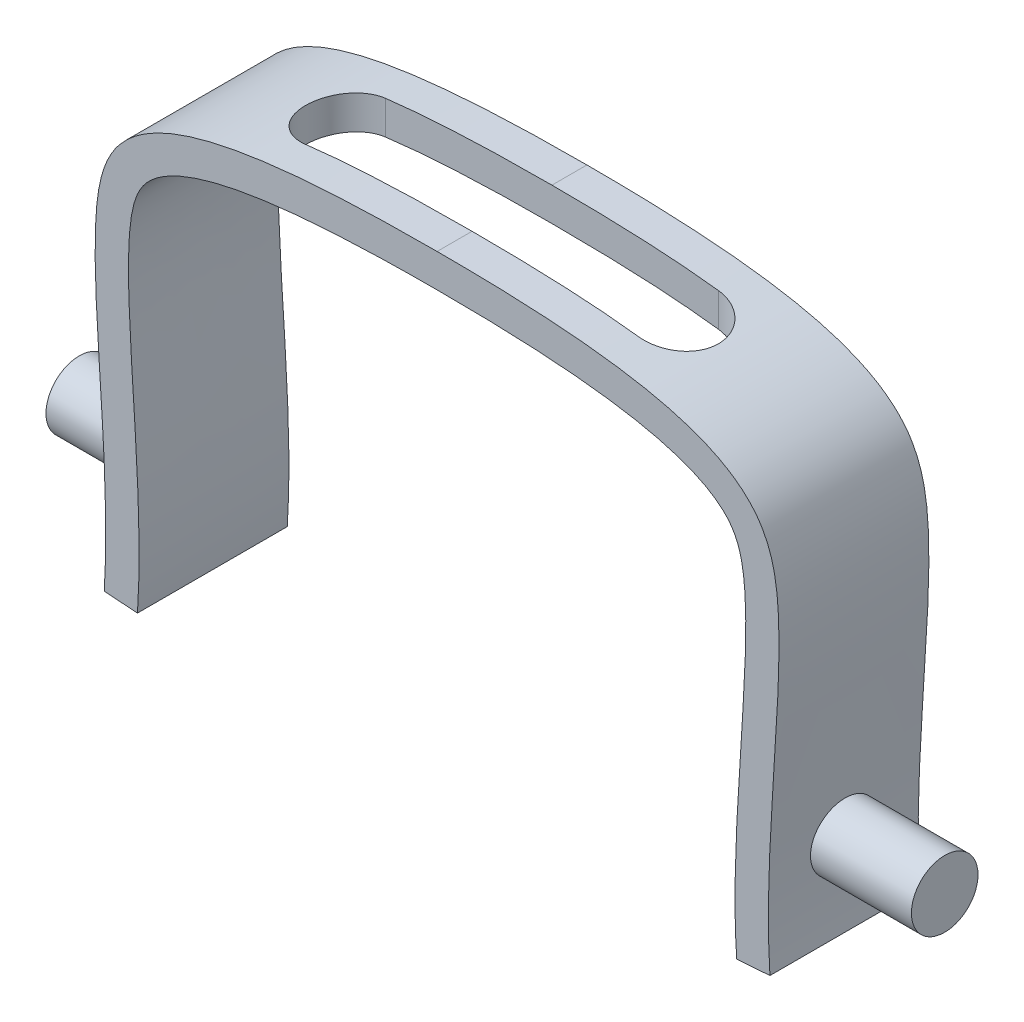
from build123d import *

# Parameters (mm, degrees)
MAIN_BODY_DEPTH              = 5.715
SLOT_FOR_JOYSTICK_DEPTH      = 127
SLOT_FOR_JOYSTICK_DEPTH_BACK = 127
SKETCH5_R                    = 2.54
NIBBLE_TWO_DEPTH             = 7.62
NIBBLE_TWO_DIRECTION_2_REACH = 64.831
SKETCH6_R                    = 2.54
NIBBLE_ONE_DEPTH             = 7.62
NIBBLE_ONE_DIRECTION_2_REACH = 70.617
SKETCH7_W                    = 3.81
SKETCH7_H                    = 1.27
FLAG_DEPTH                   = 0.254


with BuildPart() as part:
    # Sketch3 → main body (new, symmetric)
    with BuildSketch(Plane.XY):
        with BuildLine():
            Line((-25.392608442, 0.412757998), (-22.858784474, 0.235737941))
            add(Edge.make_bspline(
                [(-22.858784474, 0.235737941), (-22.207297233, 9.560974923), (-24.857071241, 24.747691028), (-20.428557404, 32.25929775), (-9.259543282, 33.02), (0, 33.02)],
                knots=[0, 0, 0, 0, 0.433889372, 0.533889372, 1, 1, 1, 1], degree=3))
            add(Edge.make_bspline(
                [(22.858784474, 0.235737941), (22.207297233, 9.560974923), (24.857071241, 24.747691028), (20.428557404, 32.25929775), (9.259543282, 33.02), (0, 33.02)],
                knots=[0, 0, 0, 0, 0.433889372, 0.533889372, 1, 1, 1, 1], degree=3))
            Line((22.858784474, 0.235737941), (25.392608442, 0.412757998))
            add(Edge.make_bspline(
                [(0, 35.56), (1.254311658, 35.56), (3.775402004, 35.537283686), (8.716263904, 35.364909913), (13.364408191, 34.95031307), (17.451619904, 34.157368544), (20.19143925, 33.318161822), (22.191145094, 32.324605138), (23.581645529, 31.247774677), (24.510467356, 30.223143514), (25.221212474, 28.976764345), (25.816104763, 27.16552201), (26.097899373, 24.685629746), (26.104154518, 21.203211789), (25.906005631, 17.271643308), (25.62301776, 13.038150403), (25.363639259, 8.672591167), (25.255928833, 5.092554321), (25.287282478, 2.342948324), (25.34716307, 1.063252489), (25.392608442, 0.412757998)],
                knots=[0, 0, 0, 0, 0.0625, 0.125, 0.25, 0.3125, 0.375, 0.4375, 0.46875, 0.5, 0.53125, 0.5625, 0.625, 0.6875, 0.75, 0.8125, 0.875, 0.9375, 0.96875, 1, 1, 1, 1], degree=3))
            add(Edge.make_bspline(
                [(-25.392608442, 0.412757998), (-25.34716307, 1.063252489), (-25.287282478, 2.342948324), (-25.255928833, 5.092554321), (-25.363639259, 8.672591167), (-25.62301776, 13.038150403), (-25.906005631, 17.271643308), (-26.104154518, 21.203211789), (-26.097899373, 24.685629746), (-25.816104763, 27.16552201), (-25.221212474, 28.976764345), (-24.510467356, 30.223143514), (-23.581645529, 31.247774677), (-22.191145094, 32.324605138), (-20.19143925, 33.318161822), (-17.451619904, 34.157368544), (-13.364408191, 34.95031307), (-8.716263904, 35.364909913), (-3.775402004, 35.537283686), (-1.254311658, 35.56), (0, 35.56)],
                knots=[0, 0, 0, 0, 0.03125, 0.0625, 0.125, 0.1875, 0.25, 0.3125, 0.375, 0.4375, 0.46875, 0.5, 0.53125, 0.5625, 0.625, 0.6875, 0.75, 0.875, 0.9375, 1, 1, 1, 1], degree=3))
        make_face()
    extrude(amount=MAIN_BODY_DEPTH, both=True)

    # Sketch4 → slot for joystick (cut, two sides: drawn at the far end of the back side and taken through both)
    with BuildSketch(Plane(origin=(0, 35.56, 0), x_dir=(1, 0, 0), z_dir=(0, 1, 0)).offset(-SLOT_FOR_JOYSTICK_DEPTH_BACK)):
        with BuildLine():
            Line((-12.7, 3.048), (12.7, 3.048))
            ThreePointArc((12.7, 3.048), (15.748, 0), (12.7, -3.048))
            Line((12.7, -3.048), (-12.7, -3.048))
            ThreePointArc((-12.7, -3.048), (-15.748, 0), (-12.7, 3.048))
        make_face()
    extrude(amount=SLOT_FOR_JOYSTICK_DEPTH + SLOT_FOR_JOYSTICK_DEPTH_BACK, mode=Mode.SUBTRACT)

    # Sketch5 → nibble two (add)
    with BuildSketch(Plane(origin=(25.392608442, 0, 0), x_dir=(0, 0, -1), z_dir=(1, 0, 0))):
        with Locations((0, 6.762757998)):
            Circle(SKETCH5_R)
    extrude(amount=NIBBLE_TWO_DEPTH)

    # Sketch5 → nibble two direction 2 (add, up to next)
    with BuildSketch(Plane(origin=(25.392608442, 0, 0), x_dir=(0, 0, -1), z_dir=(1, 0, 0)), mode=Mode.PRIVATE) as nibble_two_direction_2_sk1:
        with Locations((0, 6.762757998)):
            Circle(SKETCH5_R)
    nibble_two_direction_2_tool1 = extrude(nibble_two_direction_2_sk1.sketch, amount=-NIBBLE_TWO_DIRECTION_2_REACH, mode=Mode.PRIVATE) - part.part
    add(nibble_two_direction_2_tool1.solids().sort_by_distance((25.392608, 6.762758, 0))[0])

    # Sketch6 → nibble one (add)
    with BuildSketch(Plane(origin=(-25.392608442, 0, 0), x_dir=(0, 0, -1), z_dir=(1, 0, 0))):
        with Locations((0, 6.762757998)):
            Circle(SKETCH6_R)
    extrude(amount=-NIBBLE_ONE_DEPTH)

    # Sketch6 → nibble one direction 2 (add, up to next)
    with BuildSketch(Plane(origin=(-25.392608442, 0, 0), x_dir=(0, 0, -1), z_dir=(1, 0, 0)), mode=Mode.PRIVATE) as nibble_one_direction_2_sk1:
        with Locations((0, 6.762757998)):
            Circle(SKETCH6_R)
    nibble_one_direction_2_tool1 = extrude(nibble_one_direction_2_sk1.sketch, amount=NIBBLE_ONE_DIRECTION_2_REACH, mode=Mode.PRIVATE) - part.part
    add(nibble_one_direction_2_tool1.solids().sort_by_distance((-25.392608, 6.762758, 0))[0])

    # Sketch7 → flag (add)
    with BuildSketch(Plane(origin=(0, 6.762757998, 0), x_dir=(1, 0, 0), z_dir=(0, 1, 0))):
        with Locations((-29.429266279, -0.015489835)):
            Rectangle(SKETCH7_W, SKETCH7_H)
    extrude(amount=-FLAG_DEPTH)


solid = part.part
